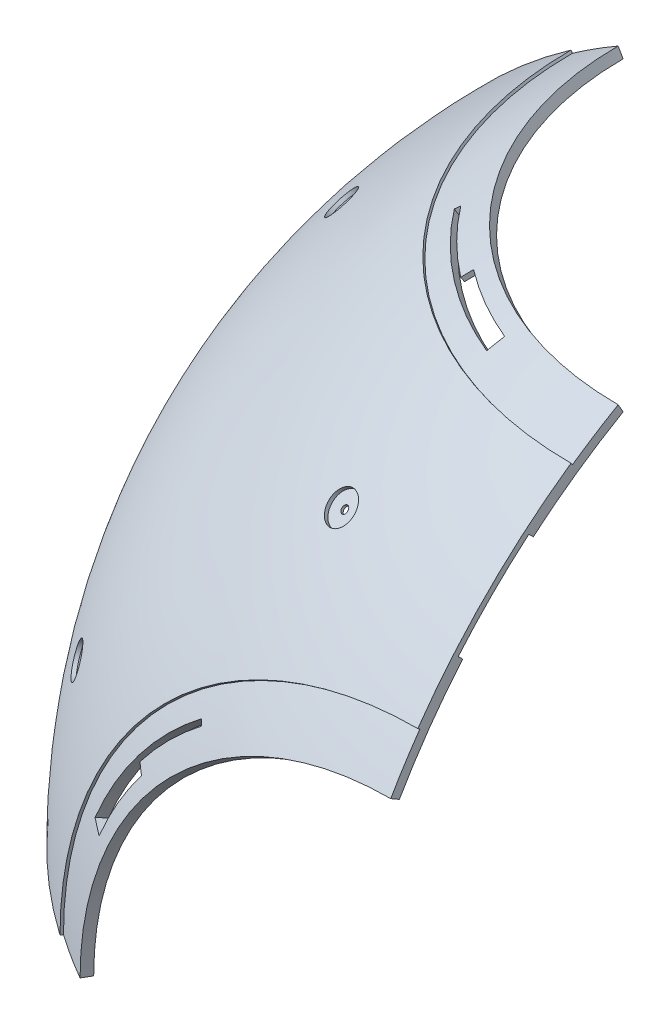
from build123d import *

# Parameters (mm, degrees)
REVOLVE1_ANGLE     = 90
CUT_REVOLVE4_ANGLE = 15
CUT_REVOLVE5_ANGLE = 15
CIRPATTERN5_COUNT  = 3
CUT_REVOLVE6_ANGLE = 20
CIRPATTERN6_COUNT  = 3
CIRPATTERN8_COUNT  = 3


with BuildPart() as part:
    # Sketch1 → Revolve1 (revolve)
    with BuildSketch(Plane.XY):
        with BuildLine():
            ThreePointArc((-245, 0), (-212.176223927, 122.5), (-122.5, 212.176223927))
            Line((-122.5, 212.176223927), (-124.5, 215.640325542))
            ThreePointArc((-124.5, 215.640325542), (-133.787602478, 210.004470007), (-142.820532651, 203.968859028))
            Line((-142.820532651, 203.968859028), (-143.394109088, 204.788011072))
            ThreePointArc((-143.394109088, 204.788011072), (-221.752708295, 115.437153309), (-250, 0))
            Line((-250, 0), (-245, 0))
        make_face()
    revolve(axis=Axis((0, 0, 0), (0, 1, 0)), revolution_arc=REVOLVE1_ANGLE)

    # Sketch2 → Cut-Revolve2 (revolve, cut)
    with BuildSketch(Plane(origin=(0, 0, 0), x_dir=(0, 0, -1), z_dir=(1, 0, 0))):
        with BuildLine():
            Line((-250, 0), (-245, 0))
            ThreePointArc((-245, 0), (-236.651827441, 63.41066605), (-212.176223927, 122.5))
            Line((-212.176223927, 122.5), (-215.640325542, 124.5))
            ThreePointArc((-215.640325542, 124.5), (-210.004470007, 133.787602478), (-203.968859028, 142.820532651))
            Line((-203.968859028, 142.820532651), (-204.788011072, 143.394109088))
            ThreePointArc((-204.788011072, 143.394109088), (-238.429237687, 75.176449876), (-250, 0))
        make_face()
    revolve(axis=Axis((0, 0, 0), (0, 0, 1)), mode=Mode.SUBTRACT)

    # Sketch3 → Cut-Revolve3 (revolve, cut)
    with BuildSketch(Plane(origin=(0, 0, 0), x_dir=(-1, 0, 0), z_dir=(0, 0, -1))):
        with BuildLine():
            ThreePointArc((212.176223927, 122.5), (236.651827441, 63.41066605), (245, 0))
            Line((245, 0), (250, 0))
            ThreePointArc((250, 0), (238.429237687, 75.176449876), (204.788011072, 143.394109088))
            Line((204.788011072, 143.394109088), (203.968859028, 142.820532651))
            ThreePointArc((203.968859028, 142.820532651), (210.004470007, 133.787602478), (215.640325542, 124.5))
            Line((215.640325542, 124.5), (212.176223927, 122.5))
        make_face()
    revolve(axis=Axis((0, 0, 0), (-1, 0, 0)), mode=Mode.SUBTRACT)

    # Sketch11 → Cut-Revolve4 (revolve, cut)
    with BuildSketch(Plane(origin=(0, 0, 0), x_dir=(-1, 0, 0), z_dir=(0, -0.3826834323650906, 0.9238795325112865))):
        with BuildLine():
            Line((212.307400924, -130.102142614), (208.896840267, -128.012148355))
            ThreePointArc((208.896840267, -128.012148355), (207.203316317, -130.735556399), (205.474289147, -133.436563579))
            Line((205.474289147, -133.436563579), (208.828971418, -135.615119719))
            ThreePointArc((208.828971418, -135.615119719), (210.586227604, -132.870014463), (212.307400924, -130.102142614))
        make_face()
    cut_revolve4 = revolve(axis=Axis((0, 0, 0), (1, 0, 0)), revolution_arc=CUT_REVOLVE4_ANGLE, mode=Mode.SUBTRACT)

    # Sketch12 → Cut-Revolve5 (revolve, cut)
    with BuildSketch(Plane(origin=(0, 0, 0), x_dir=(1, 0, 0), z_dir=(0, 0.6087614290087219, -0.7933533402912343))):
        with BuildLine():
            ThreePointArc((-205.474289147, -133.436563579), (-207.203316317, -130.735556399), (-208.896840267, -128.012148355))
            Line((-208.896840267, -128.012148355), (-210.602120595, -129.057145485))
            ThreePointArc((-210.602120595, -129.057145485), (-209.467879751, -130.890058266), (-208.317687116, -132.713003262))
            Line((-208.317687116, -132.713003262), (-210.004470007, -133.787602478))
            ThreePointArc((-210.004470007, -133.787602478), (-209.418714228, -134.702643371), (-208.828971418, -135.615119719))
            Line((-208.828971418, -135.615119719), (-205.474289147, -133.436563579))
        make_face()
    cut_revolve5 = revolve(axis=Axis((0, 0, 0), (1, 0, 0)), revolution_arc=CUT_REVOLVE5_ANGLE, mode=Mode.SUBTRACT)

    # CirPattern5: Cut-Revolve4, Cut-Revolve5 ×3 about axis
    cirpattern5_axis = Axis((9.468761978, -9.468761978, -9.468761978), (-0.5773502691896264, 0.5773502691896245, 0.5773502691896264))
    add([cut_revolve4.rotate(cirpattern5_axis, i * 360 / CIRPATTERN5_COUNT) for i in range(1, CIRPATTERN5_COUNT)], mode=Mode.SUBTRACT)
    add([cut_revolve5.rotate(cirpattern5_axis, i * 360 / CIRPATTERN5_COUNT) for i in range(1, CIRPATTERN5_COUNT)], mode=Mode.SUBTRACT)

    # Sketch20 → Cut-Revolve6 (revolve, cut)
    with BuildSketch(Plane.XZ):
        with BuildLine():
            ThreePointArc((-186.805102122, 158.520830875), (-173.241161391, 173.241161391), (-158.520830875, 186.805102122))
            Line((-158.520830875, 186.805102122), (-160.294457441, 188.578728688))
            ThreePointArc((-160.294457441, 188.578728688), (-175.008928344, 175.008928344), (-188.578728688, 160.294457441))
            Line((-188.578728688, 160.294457441), (-186.805102122, 158.520830875))
        make_face()
    cut_revolve6 = revolve(axis=Axis((-45.570162771, 0, -45.570162771), (-0.7071067811865476, 0, -0.7071067811865476)), revolution_arc=CUT_REVOLVE6_ANGLE, mode=Mode.SUBTRACT)

    # CirPattern6: Cut-Revolve6 ×3 about axis
    cirpattern6_axis = Axis((9.468761978, -9.468761978, -9.468761978), (-0.5773502691896264, 0.5773502691896245, 0.5773502691896264))
    for i in range(1, CIRPATTERN6_COUNT):
        add(cut_revolve6.rotate(cirpattern6_axis, i * 360 / CIRPATTERN6_COUNT), mode=Mode.SUBTRACT)

    # Sketch22 → Cut-Revolve13 (revolve, cut)
    with BuildSketch(Plane(origin=(0, 0, 0), x_dir=(-0.7071067811865475, 0, 0.7071067811865476), z_dir=(-0.7071067811865476, 0, -0.7071067811865475))):
        with BuildLine():
            ThreePointArc((226.549110336, 60.703651161), (226.742067307, 59.97889272), (226.932705692, 59.253520956))
            Line((226.932705692, 59.253520956), (240.416423457, 62.866472242))
            ThreePointArc((240.416423457, 62.866472242), (241.036795054, 60.444300227), (241.632764163, 58.01600885))
            Line((241.632764163, 58.01600885), (243.082145835, 58.404369498))
            ThreePointArc((243.082145835, 58.404369498), (242.302280073, 61.559768287), (241.481456572, 64.704761276))
            Line((241.481456572, 64.704761276), (226.549110336, 60.703651161))
        make_face()
    cut_revolve13 = revolve(axis=Axis((0, 0, 0), (-0.6830127018922192, 0.2588190451025214, 0.6830127018922193)), mode=Mode.SUBTRACT)

    # CirPattern8: Cut-Revolve13 ×3 about axis
    cirpattern8_axis = Axis((9.468761978, -9.468761978, -9.468761978), (-0.5773502691896264, 0.5773502691896245, 0.5773502691896264))
    for i in range(1, CIRPATTERN8_COUNT):
        add(cut_revolve13.rotate(cirpattern8_axis, i * 360 / CIRPATTERN8_COUNT), mode=Mode.SUBTRACT)


solid = part.part
